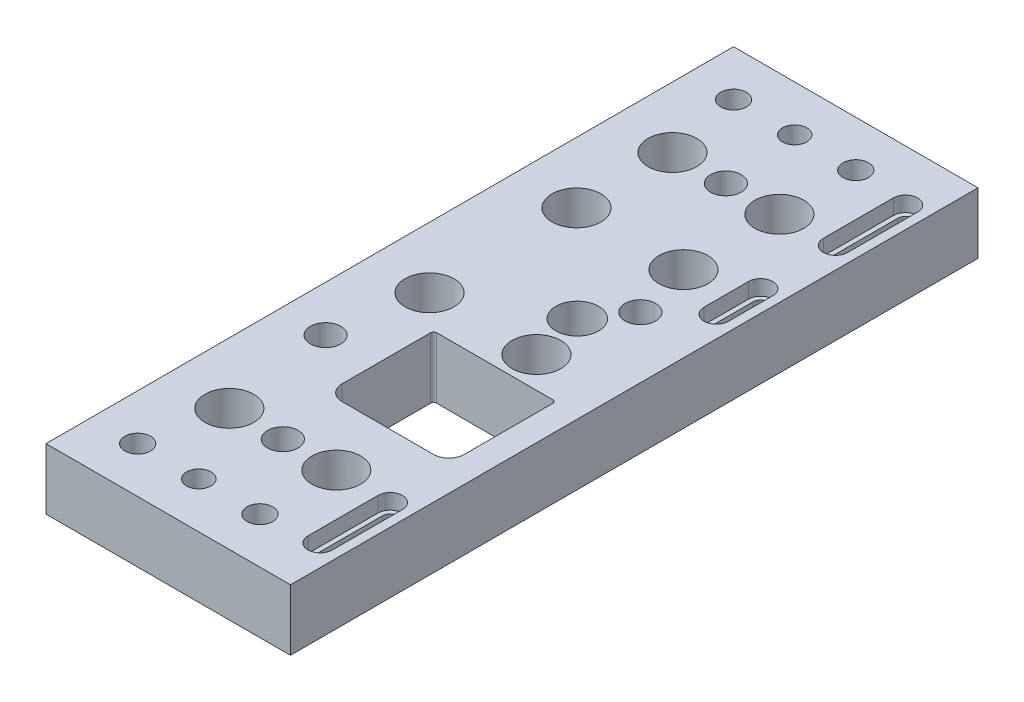
from build123d import *

# Parameters (mm, degrees)
SKETCH1_W                                    = 80
SKETCH1_H                                    = 225
BOSS_EXTRUDE1_DEPTH                          = 20
CUT_EXTRUDE1_REACH                           = 123.063
CUT_EXTRUDE2_REACH                           = 123.063
CUT_EXTRUDE3_DEPTH                           = 5
CBORE_FOR_M8_HEX_SOCKET_HEAD_CAP_SCR_2_COUNT = 2
CBORE_FOR_M8_HEX_SOCKET_HEAD_CAP_SCR_2_PITCH = 40
CBORE_FOR_M8_HEX_SOCKET_HEAD_CAP_SCR_3_COUNT = 2
CBORE_FOR_M8_HEX_SOCKET_HEAD_CAP_SCR_3_PITCH = 199.060292374
CBORE_FOR_M8_HEX_SOCKET_HEAD_CAP_SCR_4_COUNT = 2
CBORE_FOR_M8_HEX_SOCKET_HEAD_CAP_SCR_4_PITCH = 195
F_8_0MM_DOWEL_HOLE1_D                        = 8
F_8_0MM_DOWEL_HOLE1_CSINK_D                  = 8.05
F_8_0MM_DOWEL_HOLE1_CSINK_ANGLE              = 90
CUT_EXTRUDE4_REACH                           = 123.063
SKETCH13_R                                   = 8
CUT_EXTRUDE5_REACH                           = 123.063
SKETCH15_R                                   = 5
CUT_EXTRUDE6_REACH                           = 123.063
SKETCH17_R                                   = 7


with BuildPart() as part:
    # Sketch1 → Boss-Extrude1 (new body)
    with BuildSketch(Plane(origin=(0, 0, 0), x_dir=(1, 0, 0), z_dir=(0, 1, 0))):
        Rectangle(SKETCH1_W, SKETCH1_H)
    extrude(amount=-BOSS_EXTRUDE1_DEPTH)

    # Sketch2 → Cut-Extrude1 (cut, up to next)
    with BuildSketch(Plane(origin=(0, 0, 0), x_dir=(1, 0, 0), z_dir=(0, 1, 0)), mode=Mode.PRIVATE) as cut_extrude1_sk1:
        with BuildLine():
            Line((31.5, -47.14), (31.5, -18.14))
            ThreePointArc((31.5, -18.14), (31.207106781, -17.432893219), (30.5, -17.14))
            Line((30.5, -17.14), (-7.5, -17.14))
            ThreePointArc((-7.5, -17.14), (-8.207106781, -17.432893219), (-8.5, -18.14))
            Line((-8.5, -18.14), (-8.5, -47.14))
            ThreePointArc((-8.5, -47.14), (-7.035533906, -50.675533906), (-3.5, -52.14))
            Line((-3.5, -52.14), (26.5, -52.14))
            ThreePointArc((26.5, -52.14), (30.035533906, -50.675533906), (31.5, -47.14))
        make_face()
    cut_extrude1_tool1 = extrude(cut_extrude1_sk1.sketch, amount=-CUT_EXTRUDE1_REACH, mode=Mode.PRIVATE) & part.part
    add(cut_extrude1_tool1.solids().sort_by_distance((11.5, 0, 34.518764))[0], mode=Mode.SUBTRACT)

    # Sketch3 → Cut-Extrude2 (cut, up to next)
    with BuildSketch(Plane(origin=(0, 0, 0), x_dir=(1, 0, 0), z_dir=(0, 1, 0)), mode=Mode.PRIVATE) as cut_extrude2_sk1:
        with BuildLine():
            Line((35.5, -95.77), (35.5, -72.87))
            ThreePointArc((35.5, -72.87), (33, -70.37), (30.5, -72.87))
            Line((30.5, -72.87), (30.5, -95.77))
            ThreePointArc((30.5, -95.77), (33, -98.27), (35.5, -95.77))
        make_face()
    cut_extrude2_tool1 = extrude(cut_extrude2_sk1.sketch, amount=-CUT_EXTRUDE2_REACH, mode=Mode.PRIVATE) & part.part
    # Sketch3 → Cut-Extrude2 (cut, up to next)
    with BuildSketch(Plane(origin=(0, 0, 0), x_dir=(1, 0, 0), z_dir=(0, 1, 0)), mode=Mode.PRIVATE) as cut_extrude2_sk2:
        with BuildLine():
            Line((35.5, 33.86), (35.5, 48.36))
            ThreePointArc((35.5, 48.36), (33, 50.86), (30.5, 48.36))
            Line((30.5, 48.36), (30.5, 33.86))
            ThreePointArc((30.5, 33.86), (33, 31.36), (35.5, 33.86))
        make_face()
    cut_extrude2_tool2 = extrude(cut_extrude2_sk2.sketch, amount=-CUT_EXTRUDE2_REACH, mode=Mode.PRIVATE) & part.part
    # Sketch3 → Cut-Extrude2 (cut, up to next)
    with BuildSketch(Plane(origin=(0, 0, 0), x_dir=(1, 0, 0), z_dir=(0, 1, 0)), mode=Mode.PRIVATE) as cut_extrude2_sk3:
        with BuildLine():
            Line((35.5, 72.87), (35.5, 95.77))
            ThreePointArc((35.5, 95.77), (33, 98.27), (30.5, 95.77))
            Line((30.5, 95.77), (30.5, 72.87))
            ThreePointArc((30.5, 72.87), (33, 70.37), (35.5, 72.87))
        make_face()
    cut_extrude2_tool3 = extrude(cut_extrude2_sk3.sketch, amount=-CUT_EXTRUDE2_REACH, mode=Mode.PRIVATE) & part.part
    add(cut_extrude2_tool1.solids().sort_by_distance((33, 0, 84.32))[0], mode=Mode.SUBTRACT)
    add(cut_extrude2_tool2.solids().sort_by_distance((33, 0, -41.11))[0], mode=Mode.SUBTRACT)
    add(cut_extrude2_tool3.solids().sort_by_distance((33, 0, -84.32))[0], mode=Mode.SUBTRACT)

    # Sketch4 → Cut-Extrude3 (cut)
    with BuildSketch(Plane(origin=(0, 0, 0), x_dir=(1, 0, 0), z_dir=(0, 1, 0))):
        with BuildLine():
            Line((37, 72.87), (37, 95.77))
            ThreePointArc((37, 95.77), (33, 99.77), (29, 95.77))
            Line((29, 95.77), (29, 72.87))
            ThreePointArc((29, 72.87), (33, 68.87), (37, 72.87))
        make_face()
        with BuildLine():
            Line((37, 33.86), (37, 48.36))
            ThreePointArc((37, 48.36), (33, 52.36), (29, 48.36))
            Line((29, 48.36), (29, 33.86))
            ThreePointArc((29, 33.86), (33, 29.86), (37, 33.86))
        make_face()
        with BuildLine():
            Line((37, -95.77), (37, -72.87))
            ThreePointArc((37, -72.87), (33, -68.87), (29, -72.87))
            Line((29, -72.87), (29, -95.77))
            ThreePointArc((29, -95.77), (33, -99.77), (37, -95.77))
        make_face()
    extrude(amount=-CUT_EXTRUDE3_DEPTH, mode=Mode.SUBTRACT)

    # Sketch8 → CBORE for M8 Hex Socket Head Cap Screw1 (revolve, cut)
    with BuildSketch(Plane(origin=(-25, -20, -97.5), x_dir=(0, 0, -1), z_dir=(1, 0, 0))):
        Polygon((0, 0), (0, 20), (4.2, 20), (4.2, 8.6), (7.5, 8.6), (7.5, 0.025), (7.525, 0), align=None)
    cbore_for_m8_hex_socket_head_cap_screw1 = revolve(axis=Axis((-25, -26.35, -97.5), (0, 1, 0)), mode=Mode.SUBTRACT)

    # CBORE for M8 Hex Socket Head Cap Scr 2: CBORE for M8 Hex Socket Head Cap Screw1 ×2
    with Locations(*[(i * CBORE_FOR_M8_HEX_SOCKET_HEAD_CAP_SCR_2_PITCH, 0, 0) for i in range(1, CBORE_FOR_M8_HEX_SOCKET_HEAD_CAP_SCR_2_COUNT)]):
        add(cbore_for_m8_hex_socket_head_cap_screw1, mode=Mode.SUBTRACT)

    # CBORE for M8 Hex Socket Head Cap Scr 3: CBORE for M8 Hex Socket Head Cap Screw1 ×2
    with Locations(*[Vector(0.2009441437213313, 0, 0.9796027006414901) * (i * CBORE_FOR_M8_HEX_SOCKET_HEAD_CAP_SCR_3_PITCH) for i in range(1, CBORE_FOR_M8_HEX_SOCKET_HEAD_CAP_SCR_3_COUNT)]):
        add(cbore_for_m8_hex_socket_head_cap_screw1, mode=Mode.SUBTRACT)

    # CBORE for M8 Hex Socket Head Cap Scr 4: CBORE for M8 Hex Socket Head Cap Screw1 ×2
    with Locations(*[(0, 0, i * CBORE_FOR_M8_HEX_SOCKET_HEAD_CAP_SCR_4_PITCH) for i in range(1, CBORE_FOR_M8_HEX_SOCKET_HEAD_CAP_SCR_4_COUNT)]):
        add(cbore_for_m8_hex_socket_head_cap_screw1, mode=Mode.SUBTRACT)

    # Ø8.0mm Dowel Hole1 (through all)
    with Locations(Plane(origin=(0, -20, 0), x_dir=(-1, 0, 0), z_dir=(0, -1, 0))):
        with Locations((5, -97.5), (5, 97.5)):
            CounterSinkHole(F_8_0MM_DOWEL_HOLE1_D / 2, F_8_0MM_DOWEL_HOLE1_CSINK_D / 2, counter_sink_angle=F_8_0MM_DOWEL_HOLE1_CSINK_ANGLE)

    # Sketch13 → Cut-Extrude4 (cut, up to next)
    with BuildSketch(Plane(origin=(0, 0, 0), x_dir=(1, 0, 0), z_dir=(0, 1, 0)), mode=Mode.PRIVATE) as cut_extrude4_sk1:
        with Locations((15, 41.11)):
            Circle(SKETCH13_R)
    cut_extrude4_tool1 = extrude(cut_extrude4_sk1.sketch, amount=-CUT_EXTRUDE4_REACH, mode=Mode.PRIVATE) & part.part
    # Sketch13 → Cut-Extrude4 (cut, up to next)
    with BuildSketch(Plane(origin=(0, 0, 0), x_dir=(1, 0, 0), z_dir=(0, 1, 0)), mode=Mode.PRIVATE) as cut_extrude4_sk2:
        with Locations((15, -7)):
            Circle(SKETCH13_R)
    cut_extrude4_tool2 = extrude(cut_extrude4_sk2.sketch, amount=-CUT_EXTRUDE4_REACH, mode=Mode.PRIVATE) & part.part
    # Sketch13 → Cut-Extrude4 (cut, up to next)
    with BuildSketch(Plane(origin=(0, 0, 0), x_dir=(1, 0, 0), z_dir=(0, 1, 0)), mode=Mode.PRIVATE) as cut_extrude4_sk3:
        with Locations((15, -72.5)):
            Circle(SKETCH13_R)
    cut_extrude4_tool3 = extrude(cut_extrude4_sk3.sketch, amount=-CUT_EXTRUDE4_REACH, mode=Mode.PRIVATE) & part.part
    # Sketch13 → Cut-Extrude4 (cut, up to next)
    with BuildSketch(Plane(origin=(0, 0, 0), x_dir=(1, 0, 0), z_dir=(0, 1, 0)), mode=Mode.PRIVATE) as cut_extrude4_sk4:
        with Locations((-20, -72.5)):
            Circle(SKETCH13_R)
    cut_extrude4_tool4 = extrude(cut_extrude4_sk4.sketch, amount=-CUT_EXTRUDE4_REACH, mode=Mode.PRIVATE) & part.part
    # Sketch13 → Cut-Extrude4 (cut, up to next)
    with BuildSketch(Plane(origin=(0, 0, 0), x_dir=(1, 0, 0), z_dir=(0, 1, 0)), mode=Mode.PRIVATE) as cut_extrude4_sk5:
        with Locations((-20, -7)):
            Circle(SKETCH13_R)
    cut_extrude4_tool5 = extrude(cut_extrude4_sk5.sketch, amount=-CUT_EXTRUDE4_REACH, mode=Mode.PRIVATE) & part.part
    # Sketch13 → Cut-Extrude4 (cut, up to next)
    with BuildSketch(Plane(origin=(0, 0, 0), x_dir=(1, 0, 0), z_dir=(0, 1, 0)), mode=Mode.PRIVATE) as cut_extrude4_sk6:
        with Locations((-20, 41.11)):
            Circle(SKETCH13_R)
    cut_extrude4_tool6 = extrude(cut_extrude4_sk6.sketch, amount=-CUT_EXTRUDE4_REACH, mode=Mode.PRIVATE) & part.part
    # Sketch13 → Cut-Extrude4 (cut, up to next)
    with BuildSketch(Plane(origin=(0, 0, 0), x_dir=(1, 0, 0), z_dir=(0, 1, 0)), mode=Mode.PRIVATE) as cut_extrude4_sk7:
        with Locations((-20, 72.5)):
            Circle(SKETCH13_R)
    cut_extrude4_tool7 = extrude(cut_extrude4_sk7.sketch, amount=-CUT_EXTRUDE4_REACH, mode=Mode.PRIVATE) & part.part
    # Sketch13 → Cut-Extrude4 (cut, up to next)
    with BuildSketch(Plane(origin=(0, 0, 0), x_dir=(1, 0, 0), z_dir=(0, 1, 0)), mode=Mode.PRIVATE) as cut_extrude4_sk8:
        with Locations((15, 72.5)):
            Circle(SKETCH13_R)
    cut_extrude4_tool8 = extrude(cut_extrude4_sk8.sketch, amount=-CUT_EXTRUDE4_REACH, mode=Mode.PRIVATE) & part.part
    add(cut_extrude4_tool1.solids().sort_by_distance((15, 0, -41.11))[0], mode=Mode.SUBTRACT)
    add(cut_extrude4_tool2.solids().sort_by_distance((15, 0, 7))[0], mode=Mode.SUBTRACT)
    add(cut_extrude4_tool3.solids().sort_by_distance((15, 0, 72.5))[0], mode=Mode.SUBTRACT)
    add(cut_extrude4_tool4.solids().sort_by_distance((-20, 0, 72.5))[0], mode=Mode.SUBTRACT)
    add(cut_extrude4_tool5.solids().sort_by_distance((-20, 0, 7))[0], mode=Mode.SUBTRACT)
    add(cut_extrude4_tool6.solids().sort_by_distance((-20, 0, -41.11))[0], mode=Mode.SUBTRACT)
    add(cut_extrude4_tool7.solids().sort_by_distance((-20, 0, -72.5))[0], mode=Mode.SUBTRACT)
    add(cut_extrude4_tool8.solids().sort_by_distance((15, 0, -72.5))[0], mode=Mode.SUBTRACT)

    # Sketch15 → Cut-Extrude5 (cut, up to next)
    with BuildSketch(Plane(origin=(0, 0, 0), x_dir=(1, 0, 0), z_dir=(0, 1, 0)), mode=Mode.PRIVATE) as cut_extrude5_sk1:
        with Locations((-2.5, -72.5)):
            Circle(SKETCH15_R)
    cut_extrude5_tool1 = extrude(cut_extrude5_sk1.sketch, amount=-CUT_EXTRUDE5_REACH, mode=Mode.PRIVATE) & part.part
    # Sketch15 → Cut-Extrude5 (cut, up to next)
    with BuildSketch(Plane(origin=(0, 0, 0), x_dir=(1, 0, 0), z_dir=(0, 1, 0)), mode=Mode.PRIVATE) as cut_extrude5_sk2:
        with Locations((-25, -36)):
            Circle(SKETCH15_R)
    cut_extrude5_tool2 = extrude(cut_extrude5_sk2.sketch, amount=-CUT_EXTRUDE5_REACH, mode=Mode.PRIVATE) & part.part
    # Sketch15 → Cut-Extrude5 (cut, up to next)
    with BuildSketch(Plane(origin=(0, 0, 0), x_dir=(1, 0, 0), z_dir=(0, 1, 0)), mode=Mode.PRIVATE) as cut_extrude5_sk3:
        with Locations((20, 22)):
            Circle(SKETCH15_R)
    cut_extrude5_tool3 = extrude(cut_extrude5_sk3.sketch, amount=-CUT_EXTRUDE5_REACH, mode=Mode.PRIVATE) & part.part
    # Sketch15 → Cut-Extrude5 (cut, up to next)
    with BuildSketch(Plane(origin=(0, 0, 0), x_dir=(1, 0, 0), z_dir=(0, 1, 0)), mode=Mode.PRIVATE) as cut_extrude5_sk4:
        with Locations((-2.5, 72.5)):
            Circle(SKETCH15_R)
    cut_extrude5_tool4 = extrude(cut_extrude5_sk4.sketch, amount=-CUT_EXTRUDE5_REACH, mode=Mode.PRIVATE) & part.part
    add(cut_extrude5_tool1.solids().sort_by_distance((-2.5, 0, 72.5))[0], mode=Mode.SUBTRACT)
    add(cut_extrude5_tool2.solids().sort_by_distance((-25, 0, 36))[0], mode=Mode.SUBTRACT)
    add(cut_extrude5_tool3.solids().sort_by_distance((20, 0, -22))[0], mode=Mode.SUBTRACT)
    add(cut_extrude5_tool4.solids().sort_by_distance((-2.5, 0, -72.5))[0], mode=Mode.SUBTRACT)

    # Sketch17 → Cut-Extrude6 (cut, up to next)
    with BuildSketch(Plane(origin=(0, 0, 0), x_dir=(1, 0, 0), z_dir=(0, 1, 0)), mode=Mode.PRIVATE) as cut_extrude6_sk1:
        with Locations((11.5, 9.86)):
            Circle(SKETCH17_R)
    cut_extrude6_tool1 = extrude(cut_extrude6_sk1.sketch, amount=-CUT_EXTRUDE6_REACH, mode=Mode.PRIVATE) & part.part
    add(cut_extrude6_tool1.solids().sort_by_distance((11.5, 0, -9.86))[0], mode=Mode.SUBTRACT)


solid = part.part
